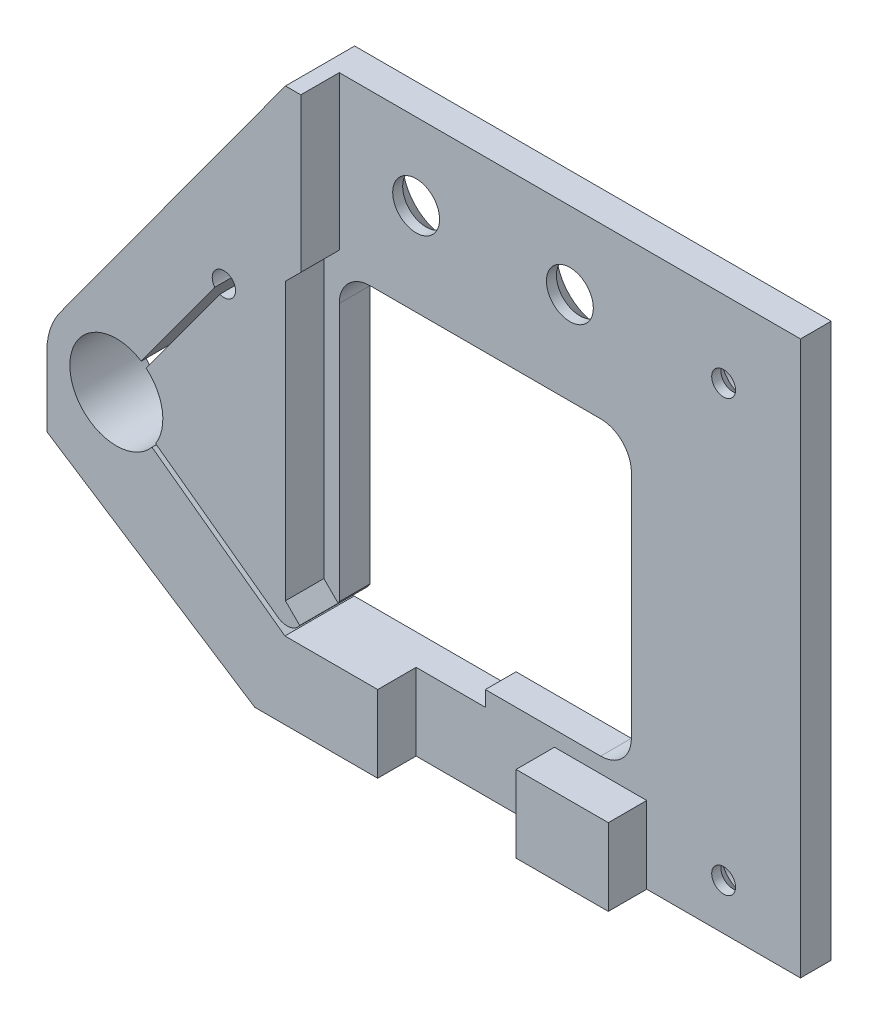
from build123d import *

# Parameters (mm, degrees)
SKETCH1_R           = 3.05
SKETCH1_R_2         = 1.55
BOSS_EXTRUDE1_DEPTH = 9
CUT_EXTRUDE1_DEPTH  = 5
CHAMFER2_SIZE       = 2.7
SKETCH3_W           = 38
SKETCH3_H           = 38
CUT_EXTRUDE2_DEPTH  = 96.66216598
FILLET1_R           = 4
CHAMFER3_SIZE       = 2
SKETCH4_R           = 3.35
CUT_EXTRUDE3_DEPTH  = 1
CHAMFER4_SIZE       = 1.8


with BuildPart() as part:
    # Sketch1 → Boss-Extrude1 (new body)
    with BuildSketch(Plane.XY):
        with BuildLine():
            Line((84, 45.5), (84, 24))
            Line((84, 24), (84, -14.5))
            Line((84, -14.5), (84, -26.5))
            Line((84, -26.5), (18, -26.5))
            Line((18, -26.5), (-9.05, -8.967177323))
            Line((-9.05, -8.967177323), (-9.05, 0))
            ThreePointArc((-9.05, 0), (-8.604128548, 2.805614358), (-7.310448193, 5.334777148))
            Line((-7.310448193, 5.334777148), (22, 45.5))
            Line((22, 45.5), (84, 45.5))
        make_face()
        with Locations((34, 35.5)):
            Circle(SKETCH1_R, mode=Mode.SUBTRACT)
        with Locations((54, 35.5)):
            Circle(SKETCH1_R, mode=Mode.SUBTRACT)
        with Locations((74, 35.5)):
            Circle(SKETCH1_R_2, mode=Mode.SUBTRACT)
        with Locations((74, -20.5)):
            Circle(SKETCH1_R_2, mode=Mode.SUBTRACT)
        with BuildLine():
            Line((43, 23.5), (43, 7.5))
            ThreePointArc((43, 7.5), (46, 4.5), (43, 1.5))
            Line((43, 1.5), (43, -16.5))
            Line((43, -16.5), (21.932011766, -16.5))
            Line((21.932011766, -16.5), (4.640610801, -3.881653178))
            ThreePointArc((4.640610801, -3.881653178), (-5.977483288, -0.933913025), (3.235425713, 5.112193312))
            Line((3.235425713, 5.112193312), (12.805005626, 18.22575293))
            ThreePointArc((12.805005626, 18.22575293), (14.884756486, 20.397148397), (13.451233091, 17.75417042))
            Line((13.451233091, 17.75417042), (3.881653178, 4.640610801))
            ThreePointArc((3.881653178, 4.640610801), (5.977483288, 0.933913025), (5.112193312, -3.235425713))
            Line((5.112193312, -3.235425713), (21.021073392, -14.84488216))
            ThreePointArc((21.021073392, -14.84488216), (23.110996656, -15.009801956), (24.2, -13.218419945))
            Line((24.2, -13.218419945), (24, 23.5))
            Line((24, 23.5), (43, 23.5))
        make_face(mode=Mode.SUBTRACT)
    extrude(amount=BOSS_EXTRUDE1_DEPTH)

    # Sketch2 → Cut-Extrude1 (cut)
    with BuildSketch(Plane.XY.offset(9)):
        Polygon((24, 25.5), (22, 25.5), (22, -12.5), (26, -16.5), (34, -16.5), (34, -26.5), (52, -26.5), (52, -16.5), (64, -16.5), (64, -26.5), (84, -26.5), (84, 45.5), (24, 45.5), align=None)
    extrude(amount=-CUT_EXTRUDE1_DEPTH, mode=Mode.SUBTRACT)

    # Chamfer2
    chamfer2_edges = [part.edges().sort_by_distance(p)[0] for p in [
        (30.95, 35.5, 0),
        (50.95, 35.5, 0),
    ]]
    chamfer(chamfer2_edges, length=CHAMFER2_SIZE)

    # Sketch3 → Cut-Extrude2 (cut, through all)
    with BuildSketch(Plane.XY.offset(4)):
        with Locations((43, 4.5)):
            Rectangle(SKETCH3_W, SKETCH3_H)
    extrude(amount=-CUT_EXTRUDE2_DEPTH, mode=Mode.SUBTRACT)

    # Fillet1
    fillet1_edges = [part.edges().sort_by_distance(p)[0] for p in [
        (62, 23.5, 2),
        (62, -14.5, 2),
        (24, 23.5, 2),
    ]]
    fillet(fillet1_edges, radius=FILLET1_R)

    # Chamfer3
    chamfer3_edges = [part.edges().sort_by_distance(p)[0] for p in [
        (22, 25.5, 6.5),
    ]]
    chamfer(chamfer3_edges, length=CHAMFER3_SIZE - 0.0001)  # a hair under: the kernel refuses the full size

    # Sketch4 → Cut-Extrude3 (cut)
    with BuildSketch(Plane(origin=(0, 0, 0), x_dir=(-1, 0, 0), z_dir=(0, 0, -1))):
        with Locations((-74, 35.5)):
            Circle(SKETCH4_R)
        with Locations((-74, -20.5)):
            Circle(SKETCH4_R)
    extrude(amount=-CUT_EXTRUDE3_DEPTH, mode=Mode.SUBTRACT)

    # Chamfer4
    chamfer4_edges = [part.edges().sort_by_distance(p)[0] for p in [
        (72.45, 35.5, 1),
        (72.45, -20.5, 1),
    ]]
    chamfer(chamfer4_edges, length=CHAMFER4_SIZE - 0.0001)  # a hair under: the kernel refuses the full size


solid = part.part
